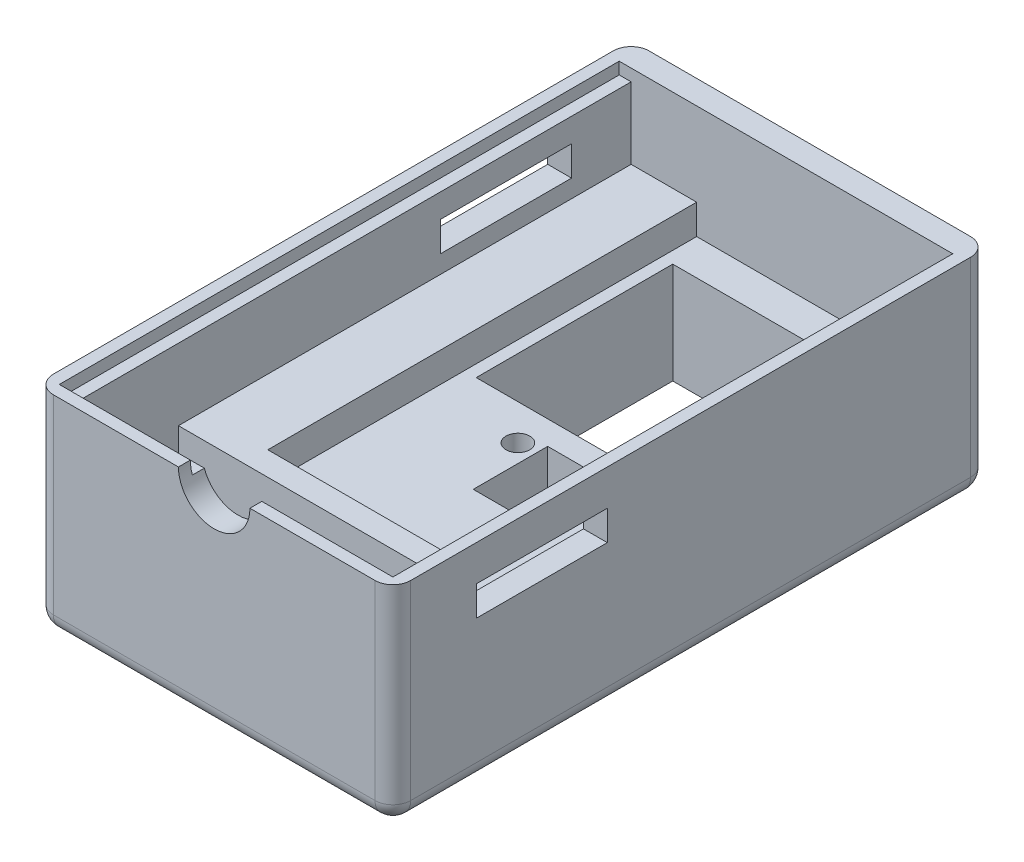
from build123d import *

# Parameters (mm, degrees)
BOSS_EXTRUDE1_DEPTH  = 17.5
CUT_EXTRUDE1_DEPTH   = 15.5
FILLET2_R            = 1.5
CUT_EXTRUDE4_REACH   = 46.612
SKETCH5_W            = 11
SKETCH5_H            = 2.5
CUT_EXTRUDE5_REACH   = 46.612
SKETCH6_W            = 11
SKETCH6_H            = 2.5
CUT_EXTRUDE6_DEPTH   = 1
BOSS_EXTRUDE7_DEPTH  = 8.5
SKETCH3_11_R         = 1
BOSS_EXTRUDE8_DEPTH  = 6
CUT_EXTRUDE8_REACH   = 38.949
SKETCH3_12_W         = 13
SKETCH3_12_H         = 16.5
BOSS_EXTRUDE9_DEPTH  = 8.5
CUT_EXTRUDE9_REACH   = 57.057
SKETCH11_W           = 25
SKETCH11_H           = 45
SKETCH11_W_2         = 13
SKETCH11_H_2         = 16.5
BOSS_EXTRUDE10_DEPTH = 0.5
CHAMFER1_SIZE        = 1
FILLET3_R            = 1


with BuildPart() as part:
    # Sketch1 → Boss-Extrude1 (new body)
    with BuildSketch(Plane(origin=(0, 0, 0), x_dir=(1, 0, 0), z_dir=(0, 1, 0))):
        Polygon((-15, 20), (15, 20), (15, -20), (15, -30), (-15, -30), (-15, -20), align=None)
    extrude(amount=BOSS_EXTRUDE1_DEPTH)

    # Sketch2 → Cut-Extrude1 (cut)
    with BuildSketch(Plane(origin=(0, 17.5, 0), x_dir=(1, 0, 0), z_dir=(0, 1, 0))):
        Polygon((-13, 18), (13, 18), (13, -18), (13, -28), (-13, -28), (-13, -18), align=None)
    extrude(amount=-CUT_EXTRUDE1_DEPTH, mode=Mode.SUBTRACT)

    # Fillet2
    fillet2_edges = [part.edges().sort_by_distance(p)[0] for p in [
        (15, 8.75, 30),
        (-15, 8.75, 30),
        (-15, 8.75, -20),
        (15, 8.75, -20),
        (0, 0, 30),
        (-15, 0, 5),
        (0, 0, -20),
        (15, 0, 5),
    ]]
    fillet(fillet2_edges, radius=FILLET2_R)

    # Sketch5 → Cut-Extrude4 (cut, up to next)
    with BuildSketch(Plane.ZY.offset(-13), mode=Mode.PRIVATE) as cut_extrude4_sk1:
        with Locations((17.5, 13.25)):
            Rectangle(SKETCH5_W, SKETCH5_H)
    cut_extrude4_tool1 = extrude(cut_extrude4_sk1.sketch, amount=-CUT_EXTRUDE4_REACH, mode=Mode.PRIVATE) & part.part
    add(cut_extrude4_tool1.solids().sort_by_distance((13, 13.25, 17.5))[0], mode=Mode.SUBTRACT)

    # Sketch6 → Cut-Extrude5 (cut, up to next)
    with BuildSketch(Plane(origin=(-13, 0, 0), x_dir=(0, 0, -1), z_dir=(1, 0, 0)), mode=Mode.PRIVATE) as cut_extrude5_sk1:
        with Locations((7.5, 13.25)):
            Rectangle(SKETCH6_W, SKETCH6_H)
    cut_extrude5_tool1 = extrude(cut_extrude5_sk1.sketch, amount=-CUT_EXTRUDE5_REACH, mode=Mode.PRIVATE) & part.part
    add(cut_extrude5_tool1.solids().sort_by_distance((-13, 13.25, -7.5))[0], mode=Mode.SUBTRACT)

    # Sketch7 → Cut-Extrude6 (cut)
    with BuildSketch(Plane(origin=(0, 17.5, 0), x_dir=(1, 0, 0), z_dir=(0, 1, 0))):
        Polygon((-13, 18), (-14, 18), (-14, -19), (-14, -29), (14, -29), (14, -19), (14, 18), (13, 18), (13, -18), (13, -28), (-13, -28), (-13, -18), align=None)
    extrude(amount=-CUT_EXTRUDE6_DEPTH, mode=Mode.SUBTRACT)

    # Sketch3 → Boss-Extrude7 (add)
    with BuildSketch(Plane(origin=(0, 2, 0), x_dir=(1, 0, 0), z_dir=(0, 1, 0))):
        Polygon((-7.5, -2.505360959), (-7.5, -1.505360959), (-7.5, 18), (-13, 18), (-13, -18), (-7.5, -18), (-7.5, -6.505360959), align=None)
        Polygon((7.5, -2.505360959), (7.5, -3.505360959), (7.5, -6.505360959), (7.5, -9.752680479), (7.5, -18), (13, -18), (13, 18), (7.5, 18), (7.5, -1.505360959), align=None)
    extrude(amount=BOSS_EXTRUDE7_DEPTH)

    # Sketch3<11> → Boss-Extrude8 (add)
    # profile 1 of 3: a face of its own
    with BuildSketch(Plane(origin=(0, 2, 0), x_dir=(1, 0, 0), z_dir=(0, 1, 0))):
        Polygon((1.5, -1.505360959), (-6.5, -1.505360959), (-7.5, -1.505360959), (-7.5, -2.505360959), (-7.5, -6.505360959), (-7.5, -18), (-1.5, -18), (1.5, -18), (7.5, -18), (7.5, -9.752680479), (1.5, -9.752680479), (1.5, -3.505360959), align=None)
        with Locations(Location((0, -4.505360959, 0), (0, 0, 270))):
            Circle(SKETCH3_11_R, mode=Mode.SUBTRACT)
    # profile 2 of 3: a face of its own
    with BuildSketch(Plane(origin=(0, 2, 0), x_dir=(1, 0, 0), z_dir=(0, 1, 0))):
        Polygon((-7.5, -1.505360959), (-6.5, -1.505360959), (-6.5, 14.994639041), (6.5, 14.994639041), (6.5, -1.505360959), (7.5, -1.505360959), (7.5, 18), (-7.5, 18), align=None)
    # profile 3 of 3: a face of its own
    with BuildSketch(Plane(origin=(0, 2, 0), x_dir=(1, 0, 0), z_dir=(0, 1, 0))):
        Polygon((6.214337826, -1.505360959), (1.5, -1.505360959), (1.5, -3.505360959), (7.5, -3.505360959), (7.5, -2.505360959), (7.5, -1.505360959), (6.5, -1.505360959), align=None)
    extrude(amount=BOSS_EXTRUDE8_DEPTH)

    # Sketch3<12> → Cut-Extrude8 (cut, up to next)
    with BuildSketch(Plane(origin=(0, 2, 0), x_dir=(1, 0, 0), z_dir=(0, 1, 0)), mode=Mode.PRIVATE) as cut_extrude8_sk1:
        with Locations((0, 6.744639041)):
            Rectangle(SKETCH3_12_W, SKETCH3_12_H)
    cut_extrude8_tool1 = extrude(cut_extrude8_sk1.sketch, amount=-CUT_EXTRUDE8_REACH, mode=Mode.PRIVATE) & part.part
    add(cut_extrude8_tool1.solids().sort_by_distance((0, 2, -6.744639))[0], mode=Mode.SUBTRACT)

    # Sketch3<13> → Boss-Extrude9 (add)
    with BuildSketch(Plane(origin=(0, 2, 0), x_dir=(1, 0, 0), z_dir=(0, 1, 0))):
        Polygon((-7.5, -18), (-13, -18), (-13, -20), (13, -20), (13, -18), (7.5, -18), (1.5, -18), (-1.5, -18), align=None)
    extrude(amount=BOSS_EXTRUDE9_DEPTH)

    # Sketch10 → Cut-Extrude9 (cut, up to next)
    with BuildSketch(Plane.XY.offset(30), mode=Mode.PRIVATE) as cut_extrude9_sk1:
        with BuildLine():
            Line((-3, 17.5), (3, 17.5))
            ThreePointArc((3, 17.5), (0, 14.5), (-3, 17.5))
        make_face()
    cut_extrude9_tool1 = extrude(cut_extrude9_sk1.sketch, amount=-CUT_EXTRUDE9_REACH, mode=Mode.PRIVATE) & part.part
    add(cut_extrude9_tool1.solids().sort_by_distance((0, 16.22676, 30))[0], mode=Mode.SUBTRACT)

    # Sketch11 → Boss-Extrude10 (add)
    with BuildSketch(Plane.XZ):
        with Locations((0, 5)):
            Rectangle(SKETCH11_W, SKETCH11_H)
        with Locations((0, -6.744639041)):
            Rectangle(SKETCH11_W_2, SKETCH11_H_2, mode=Mode.SUBTRACT)
    extrude(amount=BOSS_EXTRUDE10_DEPTH)

    # Chamfer1
    # the kernel refuses this chamfer: 1 mm, written as the material it takes off along each edge
    with BuildSketch(Plane(origin=(-15.071682988, -0.5, 27.5), x_dir=(0, -0.027495876610586403, -0.9996219169112968), z_dir=(1, 0, 0))) as chamfer1_piece_1_section:
        Polygon((CHAMFER1_SIZE * 0.999621916911, CHAMFER1_SIZE * 0.0274958766106), (-CHAMFER1_SIZE * 0.0274958766106, CHAMFER1_SIZE * 0.999621916911), (0, 0), align=None)
    chamfer1_piece_1 = extrude(amount=30.143365976, mode=Mode.PRIVATE)
    chamfer1_piece_1 = split(chamfer1_piece_1, bisect_by=Plane(origin=(0, 0, 27.106598916), z_dir=(0, -1, 0)), keep=Keep.TOP, mode=Mode.PRIVATE)
    add(chamfer1_piece_1, mode=Mode.SUBTRACT)
    with BuildSketch(Plane(origin=(-12.5, -0.5, -20.071682988), x_dir=(0.9996219169112968, -0.027495876610586403, 0), z_dir=(0, 0, 1))) as chamfer1_piece_2_section:
        Polygon((CHAMFER1_SIZE * 0.999621916911, CHAMFER1_SIZE * 0.0274958766106), (-CHAMFER1_SIZE * 0.0274958766106, CHAMFER1_SIZE * 0.999621916911), (0, 0), align=None)
    chamfer1_piece_2 = extrude(amount=50.143365976, mode=Mode.PRIVATE)
    chamfer1_piece_2 = split(chamfer1_piece_2, bisect_by=Plane(origin=(-12.106598916, 0, 5), z_dir=(0, -1, 0)), keep=Keep.TOP, mode=Mode.PRIVATE)
    add(chamfer1_piece_2, mode=Mode.SUBTRACT)
    with BuildSketch(Plane(origin=(12.5, -0.5, 30.071682988), x_dir=(-0.9996219169112968, -0.027495876610586403, 0), z_dir=(0, 0, -1))) as chamfer1_piece_3_section:
        Polygon((CHAMFER1_SIZE * 0.999621916911, CHAMFER1_SIZE * 0.0274958766106), (-CHAMFER1_SIZE * 0.0274958766106, CHAMFER1_SIZE * 0.999621916911), (0, 0), align=None)
    chamfer1_piece_3 = extrude(amount=50.143365976, mode=Mode.PRIVATE)
    chamfer1_piece_3 = split(chamfer1_piece_3, bisect_by=Plane(origin=(12.106598916, 0, 5), z_dir=(0, -1, 0)), keep=Keep.TOP, mode=Mode.PRIVATE)
    add(chamfer1_piece_3, mode=Mode.SUBTRACT)
    with BuildSketch(Plane(origin=(15.071682988, -0.5, -17.5), x_dir=(0, -0.027495876610586403, 0.9996219169112968), z_dir=(-1, 0, 0))) as chamfer1_piece_4_section:
        Polygon((CHAMFER1_SIZE * 0.999621916911, CHAMFER1_SIZE * 0.0274958766106), (-CHAMFER1_SIZE * 0.0274958766106, CHAMFER1_SIZE * 0.999621916911), (0, 0), align=None)
    chamfer1_piece_4 = extrude(amount=30.143365976, mode=Mode.PRIVATE)
    chamfer1_piece_4 = split(chamfer1_piece_4, bisect_by=Plane(origin=(0, 0, -17.106598916), z_dir=(0, -1, 0)), keep=Keep.TOP, mode=Mode.PRIVATE)
    add(chamfer1_piece_4, mode=Mode.SUBTRACT)

    # Fillet3
    fillet3_edges = [part.edges().sort_by_distance(p)[0] for p in [
        (1.5, 2, 6.629020719),
        (0, 2, 20),
    ]]
    fillet(fillet3_edges, radius=FILLET3_R)


solid = part.part
